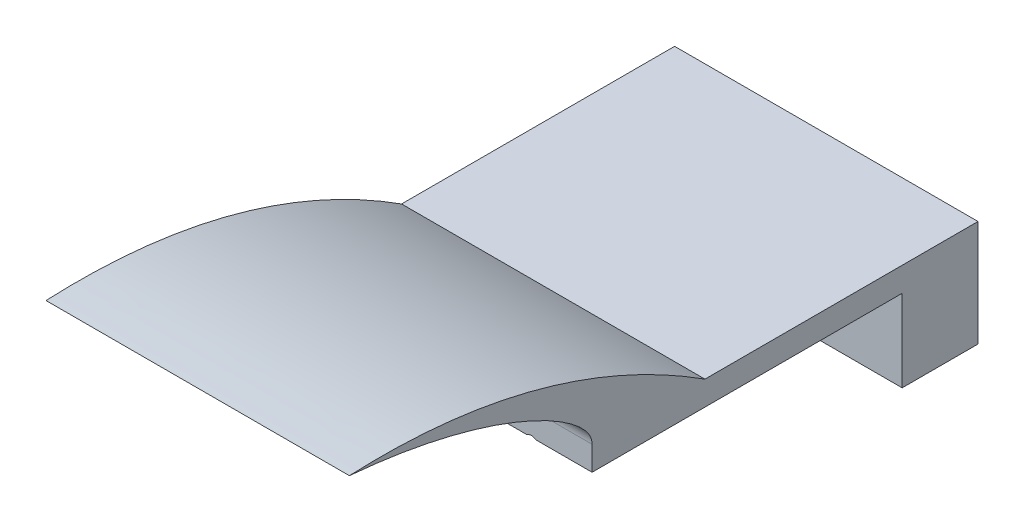
from build123d import *

# Parameters (mm, degrees)
BOSS_EXTRUDE1_DEPTH     = 63.5
CUT_EXTRUDE1_DEPTH      = 168.419011538
CUT_EXTRUDE1_DEPTH_BACK = 168.419011538
SKETCH2_R               = 3.175
BOSS_EXTRUDE2_START     = 114.3
SKETCH3_W               = 127
SKETCH3_H               = 44.45
SKETCH3_R               = 3.175
BOSS_EXTRUDE2_DEPTH     = 114.3
SKETCH4_W               = 101.6
SKETCH4_H               = 34.29
CUT_EXTRUDE2_DEPTH      = 211.546717743


with BuildPart() as part:
    # Sketch1 → Boss-Extrude1 (new, symmetric)
    with BuildSketch(Plane(origin=(0, 0, 0), x_dir=(0, 0, -1), z_dir=(1, 0, 0))):
        with BuildLine():
            Line((0.809260665, 1.527522938), (0.809260665, -8.632477062))
            Line((0.809260665, -8.632477062), (29.003260665, -8.632477062))
            Line((29.003260665, -8.632477062), (29.003260665, -42.922477062))
            Line((29.003260665, -42.922477062), (48.053260665, -42.922477062))
            Line((48.053260665, -42.922477062), (48.053260665, 1.527522938))
            add(Edge.make_bspline(
                [(-100.790739335, 40.936245598), (-19.432334381, 44.723152192), (48.053260665, 1.527522938)],
                knots=[0, 0, 0, 1, 1, 1], degree=2))
            add(Edge.make_bspline(
                [(-100.790739335, 40.936245598), (-95.812000817, 40.506536715), (-85.404095735, 39.35609048), (-70.04704926, 36.825372047), (-55.204457945, 33.455234316), (-41.848670928, 29.540032245), (-30.135862863, 25.255462099), (-20.192126341, 20.775035432), (-12.11168478, 16.271531389), (-5.930472237, 11.904209881), (-1.681652897, 7.768063044), (0.491896357, 4.287160304), (0.81175974, 2.163002008), (0.809260665, 1.527522938)],
                knots=[0.35379081, 0.35379081, 0.35379081, 0.35379081, 0.374279703, 0.396711254, 0.417576734, 0.436654006, 0.45374439, 0.468679994, 0.481329415, 0.491630702, 0.499615789, 0.505546281, 0.508115399, 0.508115399, 0.508115399, 0.508115399], degree=3))
        make_face()
    extrude(amount=BOSS_EXTRUDE1_DEPTH, both=True)

    # Sketch2 → Cut-Extrude1 (cut, two sides: drawn at the far end of the back side and taken through both)
    with BuildSketch(Plane(origin=(0, 0, -48.053260665), x_dir=(-1, 0, 0), z_dir=(0, 0, -1)).offset(-CUT_EXTRUDE1_DEPTH_BACK)):
        with Locations((-38.1, -11.172477062)):
            Circle(SKETCH2_R)
        with Locations((38.1, -11.172477062)):
            Circle(SKETCH2_R)
    extrude(amount=CUT_EXTRUDE1_DEPTH + CUT_EXTRUDE1_DEPTH_BACK, mode=Mode.SUBTRACT)

    # Sketch3 → Boss-Extrude2 (add)
    with BuildSketch(Plane(origin=(0, 0, -48.053260665), x_dir=(-1, 0, 0), z_dir=(0, 0, -1)).offset(BOSS_EXTRUDE2_START)):
        with Locations((0, -20.697477062)):
            Rectangle(SKETCH3_W, SKETCH3_H)
        with Locations((-38.1, -11.172477062)):
            Circle(SKETCH3_R, mode=Mode.SUBTRACT)
        with Locations((38.1, -11.172477062)):
            Circle(SKETCH3_R, mode=Mode.SUBTRACT)
    extrude(amount=-BOSS_EXTRUDE2_DEPTH)

    # Sketch4 → Cut-Extrude2 (cut, through all)
    with BuildSketch(Plane.ZY.offset(63.5)):
        with Locations((-79.803260665, -25.777477062)):
            Rectangle(SKETCH4_W, SKETCH4_H)
    extrude(amount=-CUT_EXTRUDE2_DEPTH, mode=Mode.SUBTRACT)


solid = part.part
